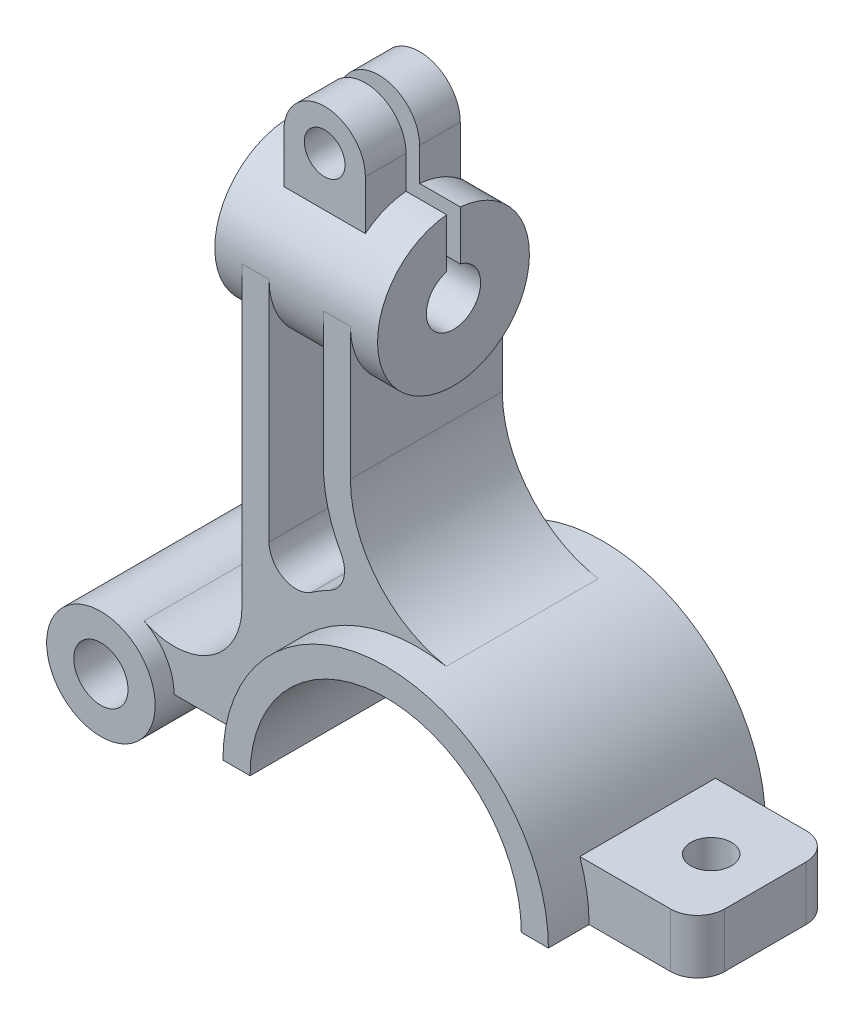
from build123d import *
from build123d.topology import SkipClean

# Parameters (mm, degrees)
BOSS_EXTRUDE1_START       = -35
BOSS_EXTRUDE1_OUTLINE_R   = 20
BOSS_EXTRUDE1_OUTLINE_R_2 = 10
BOSS_EXTRUDE1_DEPTH       = 70
BOSS_EXTRUDE2_DEPTH       = 40
SKETCH1_7_W               = 20
SKETCH1_7_H               = 20
BOSS_EXTRUDE3_DEPTH       = 25
BOSS_EXTRUDE4_DEPTH       = 28
SKETCH4_R                 = 28
SKETCH4_R_2               = 10
BOSS_EXTRUDE5_DEPTH       = 60
BOSS_EXTRUDE7_START       = -17.5
BOSS_EXTRUDE7_OUTLINE_R   = 7.5
BOSS_EXTRUDE7_DEPTH       = 35
BOSS_EXTRUDE6_DEPTH       = 28
CUT_EXTRUDE3_DEPTH        = 83
CUT_EXTRUDE3_DEPTH_BACK   = 100
SKETCH8_R                 = 7.5
CUT_EXTRUDE4_DEPTH        = 46
FILLET1_R                 = 10


# Read off the part's stored shape, not the designer's step: Boss-Extrude1, Boss-Extrude7
with BuildPart() as part:
    # Boss-Extrude1 outline → Boss-Extrude1 (new body)
    with BuildSketch(Plane.XY.offset(BOSS_EXTRUDE1_START)):
        with Locations((-110, 0)):
            Circle(BOSS_EXTRUDE1_OUTLINE_R)
        with Locations((-110, 0)):
            Circle(BOSS_EXTRUDE1_OUTLINE_R_2, mode=Mode.SUBTRACT)
    extrude(amount=BOSS_EXTRUDE1_DEPTH)



with BuildPart() as body_2:
    # Sketch1<6> → Boss-Extrude2 (new, symmetric)
    with BuildSketch(Plane.XY):
        with BuildLine():
            ThreePointArc((-50, 0), (0, 50), (50, 0))
            Line((50, 0), (60, 0))
            ThreePointArc((60, 0), (59.135913579, 10.146118724), (56.568542495, 20))
            ThreePointArc((56.568542495, 20), (38.749299446, 45.8092981), (10.342399193, 59.101901652))
            ThreePointArc((10.342399193, 59.101901652), (-38.596995015, 45.937696675), (-60, 0))
            Line((-60, 0), (-50, 0))
        make_face()
    extrude(amount=BOSS_EXTRUDE2_DEPTH, both=True)

    # Sketch1<7> → Boss-Extrude3 (add, symmetric)
    with BuildSketch(Plane.XY):
        with BuildLine():
            ThreePointArc((56.568542495, 20), (59.135913579, 10.146118724), (60, 0))
            Line((60, 0), (80, 0))
            Line((80, 0), (80, 20))
            Line((80, 20), (56.568542495, 20))
        make_face()
        with Locations((90, 10)):
            Rectangle(SKETCH1_7_W, SKETCH1_7_H)
    extrude(amount=BOSS_EXTRUDE3_DEPTH, both=True)


with BuildPart() as part_1:
    add(part.part)

    add(body_2.part)  # Boss-Extrude4 merges body 2
    # Sketch1<10> → Boss-Extrude4 (add, symmetric)
    with BuildSketch(Plane.XY):
        with BuildLine():
            Line((-90, 0), (-70, 0))
            ThreePointArc((-70, 0), (-68.738635424, 13.228756555), (-65, 25.980762114))
            Line((-65, 25.980762114), (-65, 40.311288741))
            ThreePointArc((-65, 40.311288741), (-76.823843083, 19.065374102), (-101.111111111, 17.91612833))
            ThreePointArc((-101.111111111, 17.91612833), (-93.003268288, 10.540925534), (-90, 0))
        make_face()
        with BuildLine():
            Line((-70, 0), (-60, 0))
            ThreePointArc((-60, 0), (-38.596995015, 45.937696675), (10.342399193, 59.101901652))
            ThreePointArc((10.342399193, 59.101901652), (-0.830275834, 62.694222351), (-10.603119378, 69.192296244))
            ThreePointArc((-10.603119378, 69.192296244), (-21.865731835, 66.497291458), (-32.529894875, 61.982303438))
            ThreePointArc((-32.529894875, 61.982303438), (-36.01103024, 60.026708231), (-39.375, 57.87580993))
            ThreePointArc((-39.375, 57.87580993), (-54.569759712, 43.842232208), (-65, 25.980762114))
            ThreePointArc((-65, 25.980762114), (-68.738635424, 13.228756555), (-70, 0))
        make_face()
        with BuildLine():
            Line((-65, 40.311288741), (-65, 25.980762114))
            ThreePointArc((-65, 25.980762114), (-54.569759712, 43.842232208), (-39.375, 57.87580993))
            ThreePointArc((-39.375, 57.87580993), (-49.677071733, 57.304948012), (-55, 66.143782777))
            Line((-55, 66.143782777), (-55, 136))
            Line((-55, 136), (-65, 136))
            Line((-65, 136), (-65, 40.311288741))
        make_face()
        with BuildLine():
            ThreePointArc((-32.529894875, 61.982303438), (-21.865731835, 66.497291458), (-10.603119378, 69.192296244))
            ThreePointArc((-10.603119378, 69.192296244), (-21.234787758, 83.633268621), (-25, 101.166016053))
            Line((-25, 101.166016053), (-25, 136))
            Line((-25, 136), (-35, 136))
            Line((-35, 136), (-35, 101.166016053))
            ThreePointArc((-35, 101.166016053), (-33.329691901, 88.00274883), (-28.424640616, 75.67383951))
            ThreePointArc((-28.424640616, 75.67383951), (-27.598335088, 67.964855653), (-32.529894875, 61.982303438))
        make_face()
    extrude(amount=BOSS_EXTRUDE4_DEPTH, both=True)



with BuildPart() as body_2_2:
    # Sketch4 → Boss-Extrude5 (new body)
    with BuildSketch(Plane(origin=(-15, 0, 0), x_dir=(0, 0, -1), z_dir=(1, 0, 0))):
        with Locations(Location((0, 150, 0), (0, 0, 90))):
            Circle(SKETCH4_R)
        with Locations(Location((0, 150, 0), (0, 0, 90))):
            Circle(SKETCH4_R_2, mode=Mode.SUBTRACT)
    extrude(amount=-BOSS_EXTRUDE5_DEPTH)

    # Boss-Extrude7 outline → Boss-Extrude7 (add)
    with BuildSketch(Plane.XY.offset(BOSS_EXTRUDE7_START)):
        with BuildLine():
            Line((-30, 150), (-30, 190))
            ThreePointArc((-30, 190), (-45, 205), (-60, 190))
            Line((-60, 190), (-60, 150))
            Line((-60, 150), (-30, 150))
        make_face()
        with Locations((-45, 190)):
            Circle(BOSS_EXTRUDE7_OUTLINE_R, mode=Mode.SUBTRACT)
    extrude(amount=BOSS_EXTRUDE7_DEPTH)


with BuildPart() as part_2:
    add(part_1.part)

    add(body_2_2.part)  # Boss-Extrude6 merges body 2 2
    # Sketch1<11> → Boss-Extrude6 (add, symmetric)
    with BuildSketch(Plane.XY):
        Polygon((-35, 136), (-25, 136), (-25, 150), (-30, 150), (-35, 150), align=None)
        Polygon((-65, 150), (-65, 136), (-55, 136), (-55, 150), (-60, 150), align=None)
    extrude(amount=BOSS_EXTRUDE6_DEPTH, both=True)

    # Sketch7 → Cut-Extrude3 (cut, two sides: drawn at the far end of the back side and taken through both)
    with SkipClean():  # the faces are left unmerged after this step: merging them gives an invalid solid
        with BuildSketch(Plane(origin=(-25, 0, 0), x_dir=(0, 0, -1), z_dir=(1, 0, 0)).offset(-CUT_EXTRUDE3_DEPTH_BACK)):
            with BuildLine():
                ThreePointArc((2.5, 159.682458366), (1.260042925, 159.920296963), (0, 160))
                ThreePointArc((0, 160), (-1.260042925, 159.920296963), (-2.5, 159.682458366))
                ThreePointArc((-2.5, 159.682458366), (-7.90569415, 156.123724357), (-10, 150))
                Line((-10, 150), (10, 150))
                ThreePointArc((10, 150), (7.90569415, 156.123724357), (2.5, 159.682458366))
            make_face()
            with BuildLine():
                ThreePointArc((-10, 150), (0, 140), (10, 150))
                Line((10, 150), (-10, 150))
            make_face()
            with BuildLine():
                Line((0, 205), (0, 160))
                ThreePointArc((0, 160), (1.260042925, 159.920296963), (2.5, 159.682458366))
                Line((2.5, 159.682458366), (2.5, 205))
                Line((2.5, 205), (0, 205))
            make_face()
            with BuildLine():
                ThreePointArc((-2.5, 159.682458366), (-1.260042925, 159.920296963), (0, 160))
                Line((0, 160), (0, 205))
                Line((0, 205), (-2.5, 205))
                Line((-2.5, 205), (-2.5, 159.682458366))
            make_face()
        extrude(amount=CUT_EXTRUDE3_DEPTH + CUT_EXTRUDE3_DEPTH_BACK, mode=Mode.SUBTRACT)

    # Sketch8 → Cut-Extrude4 (cut)
    with SkipClean():  # the faces are left unmerged after this step: merging them gives an invalid solid
        with BuildSketch(Plane(origin=(0, 20, 0), x_dir=(1, 0, 0), z_dir=(0, 1, 0))):
            with Locations(Location((80, 0, 0), (0, 0, 180))):
                Circle(SKETCH8_R)
        extrude(amount=-CUT_EXTRUDE4_DEPTH, mode=Mode.SUBTRACT)

    # Fillet1
    fillet1_edges = [part_2.edges().sort_by_distance(p)[0] for p in [
        (100, 10, -25),
        (100, 10, 25),
    ]]
    fillet(fillet1_edges, radius=FILLET1_R)


solid = part_2.part
